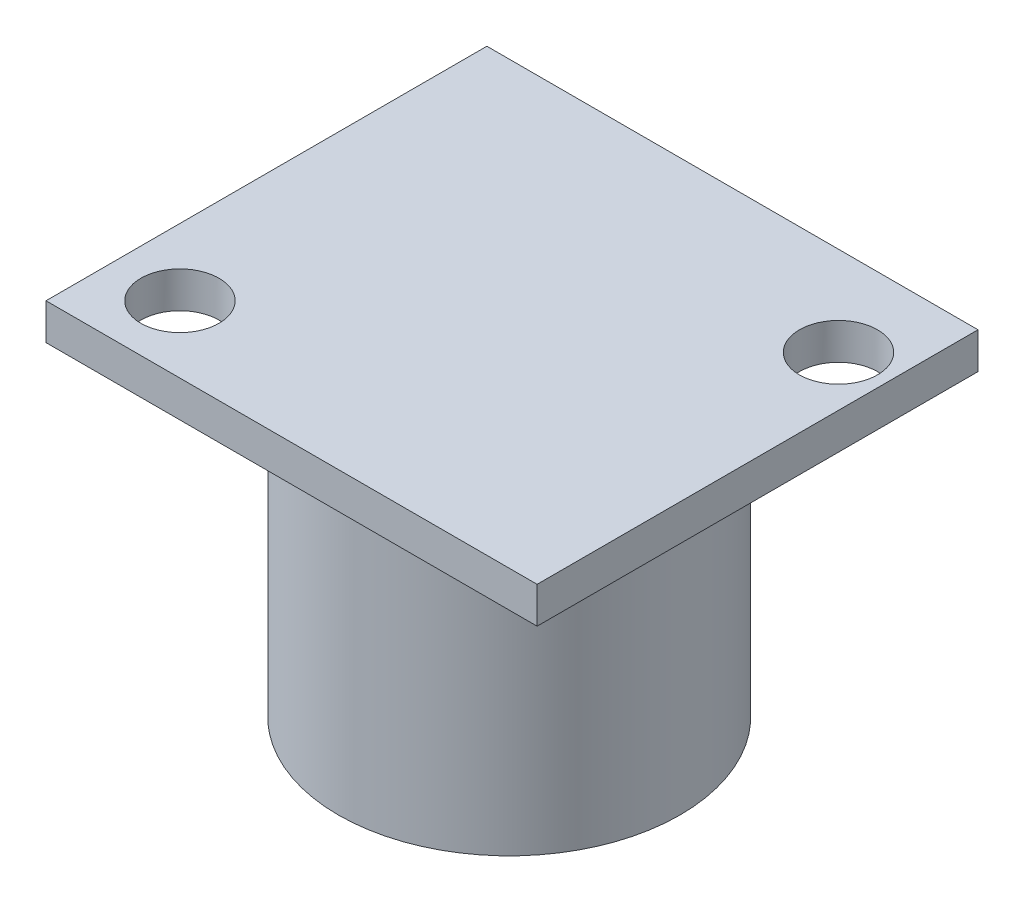
from build123d import *

# Parameters (mm, degrees)
SKETCH1_W           = 22.352
SKETCH1_H           = 20.066
BOSS_EXTRUDE1_DEPTH = 1.651
CUT_EXTRUDE1_REACH  = 32.083
SKETCH2_R           = 1.778
SKETCH3_R           = 7.775648419
SKETCH3_R_2         = 6.862234512
BOSS_EXTRUDE2_DEPTH = 13.716


with BuildPart() as part:
    # Sketch1 → Boss-Extrude1 (new body)
    with BuildSketch(Plane(origin=(0, 0, 0), x_dir=(1, 0, 0), z_dir=(0, 1, 0))):
        with Locations((11.176, 10.033)):
            Rectangle(SKETCH1_W, SKETCH1_H)
    extrude(amount=BOSS_EXTRUDE1_DEPTH)

    # Sketch2 → Cut-Extrude1 (cut, up to next)
    with BuildSketch(Plane(origin=(0, 1.651, 0), x_dir=(1, 0, 0), z_dir=(0, 1, 0)), mode=Mode.PRIVATE) as cut_extrude1_sk1:
        with Locations((3.048, 3.048)):
            Circle(SKETCH2_R)
    cut_extrude1_tool1 = extrude(cut_extrude1_sk1.sketch, amount=-CUT_EXTRUDE1_REACH, mode=Mode.PRIVATE) & part.part
    # Sketch2 → Cut-Extrude1 (cut, up to next)
    with BuildSketch(Plane(origin=(0, 1.651, 0), x_dir=(1, 0, 0), z_dir=(0, 1, 0)), mode=Mode.PRIVATE) as cut_extrude1_sk2:
        with Locations((20.066, 16.002)):
            Circle(SKETCH2_R)
    cut_extrude1_tool2 = extrude(cut_extrude1_sk2.sketch, amount=-CUT_EXTRUDE1_REACH, mode=Mode.PRIVATE) & part.part
    add(cut_extrude1_tool1.solids().sort_by_distance((3.048, 1.651, -3.048))[0], mode=Mode.SUBTRACT)
    add(cut_extrude1_tool2.solids().sort_by_distance((20.066, 1.651, -16.002))[0], mode=Mode.SUBTRACT)

    # Sketch3 → Boss-Extrude2 (add)
    with BuildSketch(Plane.XZ):
        with Locations((11.557, -9.525)):
            Circle(SKETCH3_R)
        with Locations((11.557, -9.525)):
            Circle(SKETCH3_R_2, mode=Mode.SUBTRACT)
    extrude(amount=BOSS_EXTRUDE2_DEPTH)


solid = part.part
